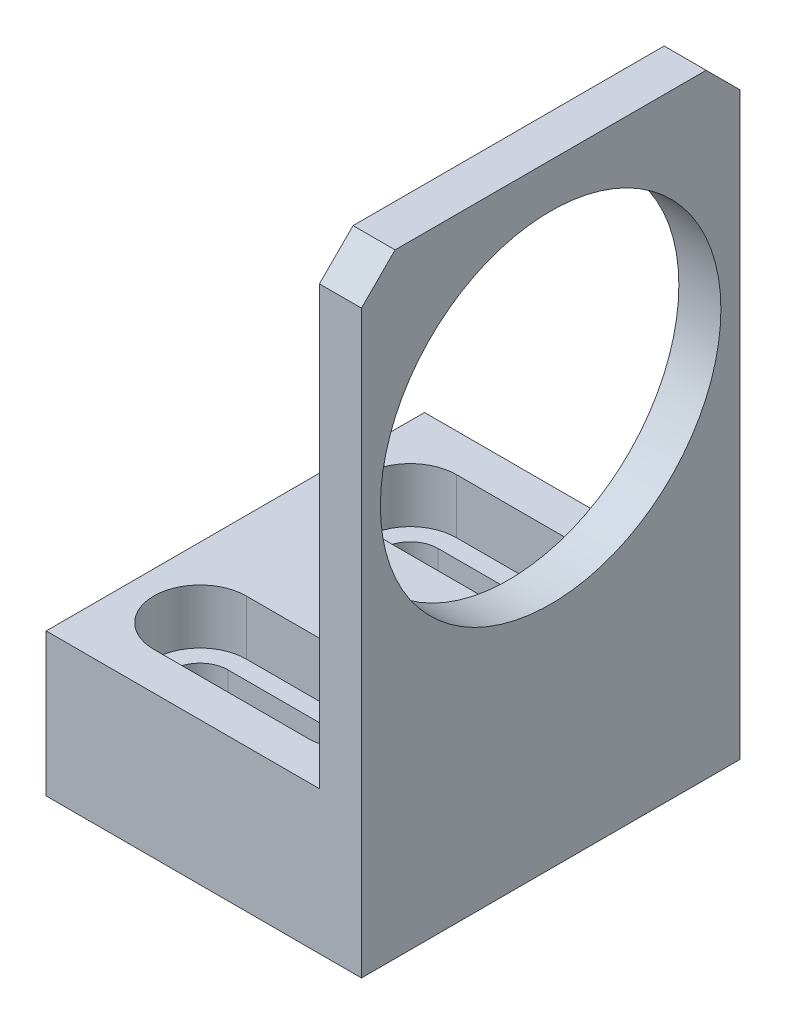
from build123d import *

# Parameters (mm, degrees)
SKETCH1_W                                      = 45
SKETCH1_H                                      = 73
SKETCH1_R                                      = 20.25
BOSS_EXTRUDE1_DEPTH                            = 5
CHAMFER1_SIZE                                  = 4
SKETCH2_W                                      = 45
SKETCH2_H                                      = 17
BOSS_EXTRUDE2_DEPTH                            = 32.5
CBORE_SLOT_FOR_M6_HEX_SOCKET_HEAD_CAP_SC_DEPTH = 17
CBORE_START                                    = 10.5
CBORE_SLOT_FOR_M6_HEX_SOCKET_HEAD_CA_3_DEPTH   = 6.5


# Read off the part's stored shape, not the designer's step: CBORE SLOT for M6 Hex Socket Head Cap Screw1
with BuildPart() as part:
    # Sketch1 → Boss-Extrude1 (new body)
    with BuildSketch(Plane(origin=(0, 0, 0), x_dir=(0, 0, -1), z_dir=(1, 0, 0))):
        with Locations((0, 36.5)):
            Rectangle(SKETCH1_W, SKETCH1_H)
        with Locations((0, 47.5)):
            Circle(SKETCH1_R, mode=Mode.SUBTRACT)
    extrude(amount=BOSS_EXTRUDE1_DEPTH)

    # Chamfer1
    chamfer1_edges = [part.edges().sort_by_distance(p)[0] for p in [
        (2.5, 73, 22.5),
        (2.5, 73, -22.5),
    ]]
    chamfer(chamfer1_edges, length=CHAMFER1_SIZE)

    # Sketch2 → Boss-Extrude2 (add)
    with BuildSketch(Plane.ZY):
        with Locations((0, 8.5)):
            Rectangle(SKETCH2_W, SKETCH2_H)
    extrude(amount=BOSS_EXTRUDE2_DEPTH)

    # CBORE SLOT for M6 Hex Socket Head Ca 2 → CBORE SLOT for M6 Hex Socket Head Cap Screw1 (cut)
    with BuildSketch(Plane(origin=(0, 0, 0), x_dir=(1, 0, 0), z_dir=(0, 1, 0))):
        with BuildLine():
            Line((-24.2, -15.8), (-5.8, -15.8))
            ThreePointArc((-5.8, -15.8), (-2.5, -12.5), (-5.8, -9.2))
            Line((-5.8, -9.2), (-24.2, -9.2))
            ThreePointArc((-24.2, -9.2), (-27.5, -12.5), (-24.2, -15.8))
        make_face()
        with BuildLine():
            Line((-24.2, 9.2), (-5.8, 9.2))
            ThreePointArc((-5.8, 9.2), (-2.5, 12.5), (-5.8, 15.8))
            Line((-5.8, 15.8), (-24.2, 15.8))
            ThreePointArc((-24.2, 15.8), (-27.5, 12.5), (-24.2, 9.2))
        make_face()
    extrude(amount=CBORE_SLOT_FOR_M6_HEX_SOCKET_HEAD_CAP_SC_DEPTH, mode=Mode.SUBTRACT)

    # CBORE SLOT for M6 Hex Socket Head Ca 3 o → CBORE SLOT for M6 Hex Socket Head Ca 3 (cut)
    # profile 1 of 2: a face of its own
    with BuildSketch(Plane(origin=(0, 0, 0), x_dir=(1, 0, 0), z_dir=(0, 1, 0)).offset(CBORE_START)):
        with BuildLine():
            Line((-24.2, -18), (-5.8, -18))
            ThreePointArc((-5.8, -18), (-0.3, -12.5), (-5.8, -7))
            Line((-5.8, -7), (-24.2, -7))
            ThreePointArc((-24.2, -7), (-29.7, -12.5), (-24.2, -18))
        make_face()
        with BuildLine():
            ThreePointArc((-5.8, -9.2), (-2.5, -12.5), (-5.8, -15.8))
            Line((-5.8, -15.8), (-24.2, -15.8))
            ThreePointArc((-24.2, -15.8), (-27.5, -12.5), (-24.2, -9.2))
            Line((-24.2, -9.2), (-5.8, -9.2))
        make_face(mode=Mode.SUBTRACT)
    # profile 2 of 2: a face of its own
    with BuildSketch(Plane(origin=(0, 0, 0), x_dir=(1, 0, 0), z_dir=(0, 1, 0)).offset(CBORE_START)):
        with BuildLine():
            Line((-24.2, 7), (-5.8, 7))
            ThreePointArc((-5.8, 7), (-0.3, 12.5), (-5.8, 18))
            Line((-5.8, 18), (-24.2, 18))
            ThreePointArc((-24.2, 18), (-29.7, 12.5), (-24.2, 7))
        make_face()
        with BuildLine():
            ThreePointArc((-5.8, 15.8), (-2.5, 12.5), (-5.8, 9.2))
            Line((-5.8, 9.2), (-24.2, 9.2))
            ThreePointArc((-24.2, 9.2), (-27.5, 12.5), (-24.2, 15.8))
            Line((-24.2, 15.8), (-5.8, 15.8))
        make_face(mode=Mode.SUBTRACT)
    extrude(amount=CBORE_SLOT_FOR_M6_HEX_SOCKET_HEAD_CA_3_DEPTH, mode=Mode.SUBTRACT)


solid = part.part
